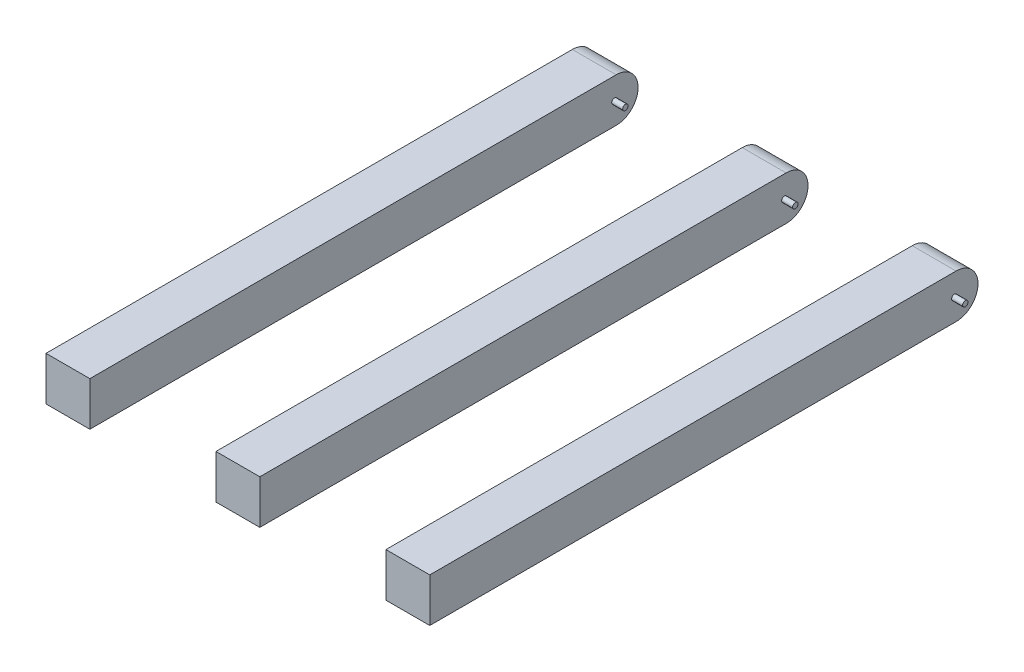
from build123d import *

# Parameters (mm, degrees)
SKETCH2_W           = 0.8
SKETCH2_H           = 0.8
BOSS_EXTRUDE1_DEPTH = 10
SKETCH3_R           = 0.05
BOSS_EXTRUDE2_DEPTH = 0.2
FILLET1_R           = 0.4
LPATTERN1_COUNT     = 2
LPATTERN1_PITCH     = 3.1
LPATTERN1_2_COUNT   = 2
LPATTERN1_2_PITCH   = 3.1


with BuildPart() as part:
    # Sketch2 → Boss-Extrude1 (new body)
    with BuildSketch(Plane.XY):
        Rectangle(SKETCH2_W, SKETCH2_H)
    extrude(amount=BOSS_EXTRUDE1_DEPTH)

    # Sketch3 → Boss-Extrude2 (add)
    with BuildSketch(Plane(origin=(0.4, 0, 0), x_dir=(0, 0, -1), z_dir=(1, 0, 0))):
        with Locations(Location((-0.431172897, 0, 0), (0, 0, 90))):
            Circle(SKETCH3_R)
    extrude(amount=BOSS_EXTRUDE2_DEPTH)

    # Fillet1
    fillet1_edges = [part.edges().sort_by_distance(p)[0] for p in [
        (0, -0.4, 0),
        (0, 0.4, 0),
    ]]
    fillet(fillet1_edges, radius=FILLET1_R - 0.0001)  # a hair under: the kernel refuses the full size


with BuildPart() as lpattern1_1:
    # LPattern1: pattern copy
    add(part.part.moved(Location(Vector(1, 0, 0) * (1 * LPATTERN1_PITCH))))


with BuildPart() as lpattern1_2_1:
    # LPattern1 2: pattern copy
    add(part.part.moved(Location(Vector(-1, 0, 0) * (1 * LPATTERN1_2_PITCH))))


solid = Compound([part.part, lpattern1_1.part, lpattern1_2_1.part])
